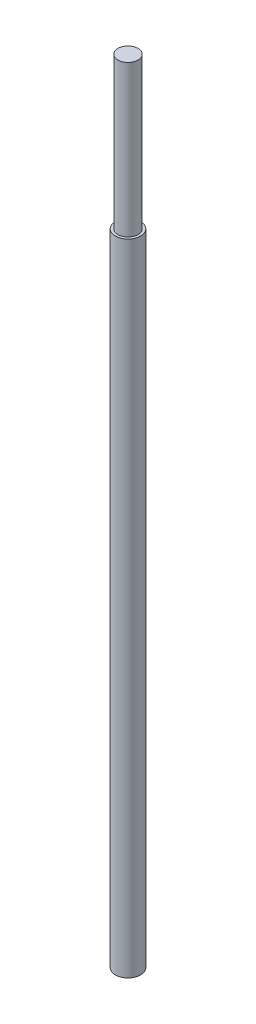
from build123d import *

# Parameters (mm, degrees)
SKETCH1_R           = 5
BOSS_EXTRUDE1_DEPTH = 254
SKETCH2_R           = 4
BOSS_EXTRUDE2_DEPTH = 60


with BuildPart() as part:
    # Sketch1 → Boss-Extrude1 (new body)
    with BuildSketch(Plane(origin=(0, 0, 0), x_dir=(1, 0, 0), z_dir=(0, 1, 0))):
        Circle(SKETCH1_R)
    extrude(amount=BOSS_EXTRUDE1_DEPTH)

    # Sketch2 → Boss-Extrude2 (add)
    with BuildSketch(Plane(origin=(0, 254, 0), x_dir=(1, 0, 0), z_dir=(0, 1, 0))):
        Circle(SKETCH2_R)
    extrude(amount=BOSS_EXTRUDE2_DEPTH)


solid = part.part
